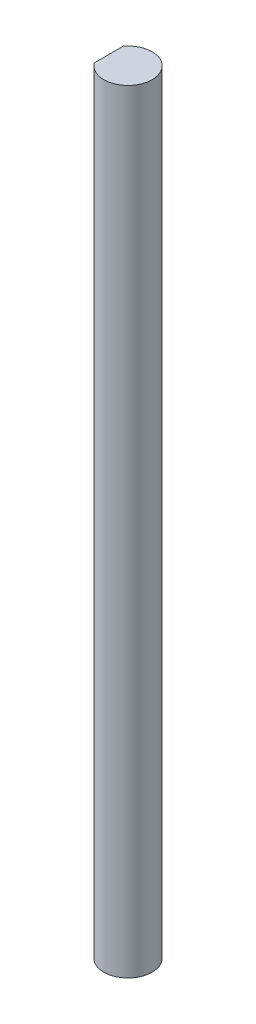
from build123d import *

# Parameters (mm, degrees)
BOSS_EXTRUDE1_DEPTH = 50.8


with BuildPart() as part:
    # Sketch1 → Boss-Extrude1 (new, symmetric)
    with BuildSketch(Plane(origin=(0, 0, 0), x_dir=(1, 0, 0), z_dir=(0, 1, 0))):
        with BuildLine():
            Line((-2.54, -1.905), (-2.54, 1.905))
            ThreePointArc((-2.54, 1.905), (3.175, 0), (-2.54, -1.905))
        make_face()
    extrude(amount=BOSS_EXTRUDE1_DEPTH, both=True)


solid = part.part
